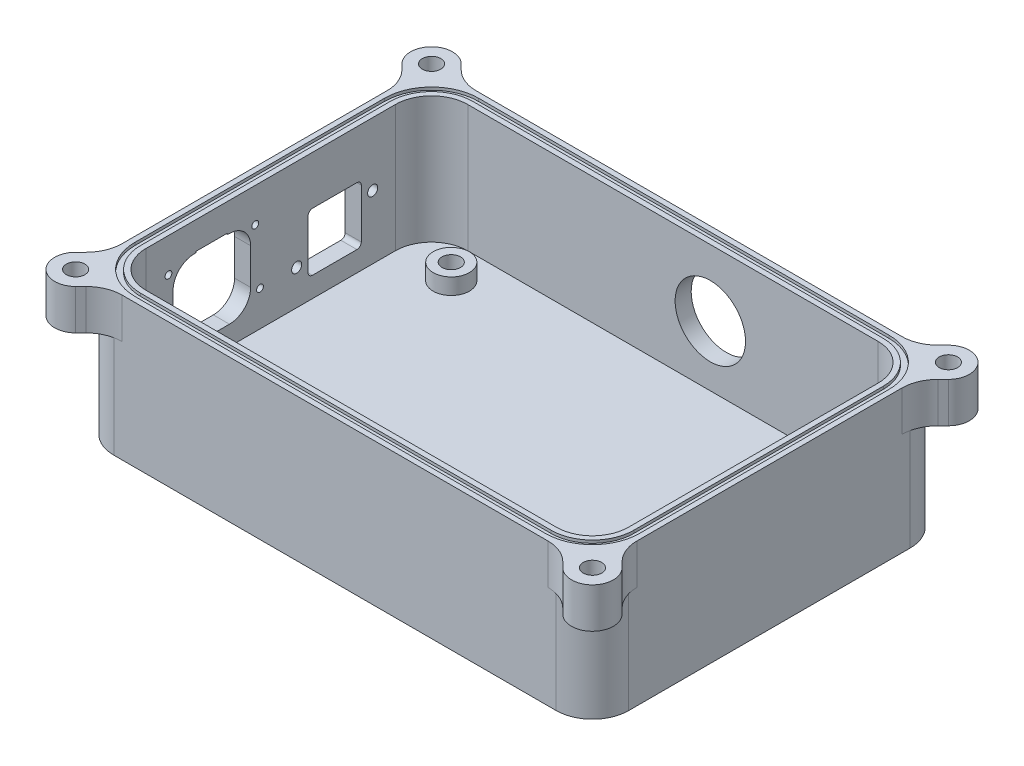
from build123d import *

# Parameters (mm, degrees)
SKETCH1_W                                = 152.4
SKETCH1_H                                = 101.6
BOSS_EXTRUDE1_DEPTH                      = 40.005
SHELL1_T                                 = 5.08
SKETCH5_R                                = 5.715
SKETCH5_R_2                              = 2.921
BOSS_EXTRUDE2_DEPTH                      = 5.08
SKETCH3_R                                = 1.6
SKETCH3_W                                = 10
SKETCH3_H                                = 0.4
CUT_EXTRUDE2_DEPTH                       = 5.08
BOSS_EXTRUDE3_DEPTH                      = 12.7
CUT_EXTRUDE3_DEPTH                       = 8.89
MIRROR1_AT_THE_SECOND_PLANE_COPY_1_DEPTH = 12.7
MIRROR1_AT_THE_SECOND_PLANE_COPY_2_DEPTH = 8.89
FILLET1_R                                = 11.43
FILLET2_R                                = 11.43
CUT_EXTRUDE4_DEPTH                       = 0.889
SKETCH10_R                               = 11.1125
CUT_EXTRUDE5_DEPTH                       = 5.08


with BuildPart() as part:
    # Sketch1 → Boss-Extrude1 (new body)
    with BuildSketch(Plane(origin=(0, 0, 0), x_dir=(1, 0, 0), z_dir=(0, 1, 0))):
        Rectangle(SKETCH1_W, SKETCH1_H)
    extrude(amount=BOSS_EXTRUDE1_DEPTH)

    # Shell1
    shell1_openings = [part.faces().sort_by_distance(p)[0] for p in [
        (0, 40.005, 0),
    ]]
    offset(amount=SHELL1_T, openings=shell1_openings, kind=Kind.INTERSECTION)

    # Sketch5 → Boss-Extrude2 (add)
    # profile 1 of 4: a face of its own
    with BuildSketch(Plane(origin=(0, 0, 0), x_dir=(-1, 0, 0), z_dir=(0, -1, 0))):
        with Locations(Location((59.182, 40.005, 0), (0, 0, 90))):
            Circle(SKETCH5_R)
        with Locations(Location((59.182, 40.005, 0), (0, 0, 90))):
            Circle(SKETCH5_R_2, mode=Mode.SUBTRACT)
    # profile 2 of 4: a face of its own
    with BuildSketch(Plane(origin=(0, 0, 0), x_dir=(-1, 0, 0), z_dir=(0, -1, 0))):
        with Locations(Location((-51.308, 40.005, 0), (0, 0, 90))):
            Circle(SKETCH5_R)
        with Locations(Location((-51.308, 40.005, 0), (0, 0, 90))):
            Circle(SKETCH5_R_2, mode=Mode.SUBTRACT)
    # profile 3 of 4: a face of its own
    with BuildSketch(Plane(origin=(0, 0, 0), x_dir=(-1, 0, 0), z_dir=(0, -1, 0))):
        with Locations(Location((-15.748, -24.765, 0), (0, 0, 90))):
            Circle(SKETCH5_R)
        with Locations(Location((-15.748, -24.765, 0), (0, 0, 90))):
            Circle(SKETCH5_R_2, mode=Mode.SUBTRACT)
    # profile 4 of 4: a face of its own
    with BuildSketch(Plane(origin=(0, 0, 0), x_dir=(-1, 0, 0), z_dir=(0, -1, 0))):
        with Locations(Location((59.182, -40.005, 0), (0, 0, 90))):
            Circle(SKETCH5_R)
        with Locations(Location((59.182, -40.005, 0), (0, 0, 90))):
            Circle(SKETCH5_R_2, mode=Mode.SUBTRACT)
    extrude(amount=-BOSS_EXTRUDE2_DEPTH)

    # Sketch3 → Cut-Extrude2 (cut)
    with BuildSketch(Plane(origin=(-81.28, 0, 0), x_dir=(0, 0, -1), z_dir=(1, 0, 0))):
        with BuildLine():
            ThreePointArc((13.196001907, 24.702820577), (12.220194549, 24.298627935), (11.816001907, 23.322820577))
            Line((11.816001907, 23.322820577), (11.816001907, 7.782820577))
            ThreePointArc((11.816001907, 7.782820577), (12.220194549, 6.807013219), (13.196001907, 6.402820577))
            Line((13.196001907, 6.402820577), (27.236001907, 6.402820577))
            ThreePointArc((27.236001907, 6.402820577), (28.211809265, 6.807013219), (28.616001907, 7.782820577))
            Line((28.616001907, 7.782820577), (28.616001907, 23.322820577))
            ThreePointArc((28.616001907, 23.322820577), (28.211809265, 24.298627935), (27.236001907, 24.702820577))
            Line((27.236001907, 24.702820577), (13.196001907, 24.702820577))
        make_face()
        with Locations(Location((32.21600191, 20.052820577, 0), (0, 0, 180))):
            Circle(SKETCH3_R)
        with Locations(Location((8.21600191, 11.052820577, 0), (0, 0, 180))):
            Circle(SKETCH3_R)
        with BuildLine():
            ThreePointArc((-24.109953079, 30.922549735), (-28.847568513, 28.960165169), (-30.809953079, 24.222549735))
            Line((-30.809953079, 24.222549735), (-30.809953079, 12.822549735))
            ThreePointArc((-30.809953079, 12.822549735), (-28.847568513, 8.084934302), (-24.109953079, 6.122549735))
            Line((-24.109953079, 6.122549735), (-13.009953079, 6.122549735))
            ThreePointArc((-13.009953079, 6.122549735), (-8.272337645, 8.084934302), (-6.309953079, 12.822549735))
            Line((-6.309953079, 12.822549735), (-6.309953079, 24.222549735))
            ThreePointArc((-6.309953079, 24.222549735), (-8.272337645, 28.960165169), (-13.009953079, 30.922549735))
            Line((-13.009953079, 30.922549735), (-24.109953079, 30.922549735))
        make_face()
        with BuildLine():
            add(Edge.make_bspline(
                [(-5.944953079, 29.222549735), (-5.944953079, 31.392549735), (-3.774953079, 31.392549735), (-3.774953079, 29.222549735)],
                knots=[0, 0, 0, 0, 1, 1, 1, 1], degree=3, weights=[1, 0.333333333, 0.333333333, 1]))
            add(Edge.make_bspline(
                [(-3.774953079, 29.222549735), (-3.774953079, 27.052549735), (-5.944953079, 27.052549735), (-5.944953079, 29.222549735)],
                knots=[0, 0, 0, 0, 1, 1, 1, 1], degree=3, weights=[1, 0.333333333, 0.333333333, 1]))
        make_face()
        with BuildLine():
            add(Edge.make_bspline(
                [(-4.444953079, 11.122549735), (-4.444953079, 13.292549735), (-2.274953079, 13.292549735), (-2.274953079, 11.122549735)],
                knots=[0, 0, 0, 0, 1, 1, 1, 1], degree=3, weights=[1, 0.333333333, 0.333333333, 1]))
            add(Edge.make_bspline(
                [(-2.274953079, 11.122549735), (-2.274953079, 8.952549735), (-4.444953079, 8.952549735), (-4.444953079, 11.122549735)],
                knots=[0, 0, 0, 0, 1, 1, 1, 1], degree=3, weights=[1, 0.333333333, 0.333333333, 1]))
        make_face()
        with BuildLine():
            add(Edge.make_bspline(
                [(-33.344953079, 29.222549735), (-33.344953079, 31.392549735), (-31.174953079, 31.392549735), (-31.174953079, 29.222549735)],
                knots=[0, 0, 0, 0, 1, 1, 1, 1], degree=3, weights=[1, 0.333333333, 0.333333333, 1]))
            add(Edge.make_bspline(
                [(-31.174953079, 29.222549735), (-31.174953079, 27.052549735), (-33.344953079, 27.052549735), (-33.344953079, 29.222549735)],
                knots=[0, 0, 0, 0, 1, 1, 1, 1], degree=3, weights=[1, 0.333333333, 0.333333333, 1]))
        make_face()
        with BuildLine():
            add(Edge.make_bspline(
                [(-34.844953079, 11.122549735), (-34.844953079, 13.292549735), (-32.674953079, 13.292549735), (-32.674953079, 11.122549735)],
                knots=[0, 0, 0, 0, 1, 1, 1, 1], degree=3, weights=[1, 0.333333333, 0.333333333, 1]))
            add(Edge.make_bspline(
                [(-32.674953079, 11.122549735), (-32.674953079, 8.952549735), (-34.844953079, 8.952549735), (-34.844953079, 11.122549735)],
                knots=[0, 0, 0, 0, 1, 1, 1, 1], degree=3, weights=[1, 0.333333333, 0.333333333, 1]))
        make_face()
        with Locations((-18.559953079, 31.122549735)):
            Rectangle(SKETCH3_W, SKETCH3_H)
    extrude(amount=CUT_EXTRUDE2_DEPTH, mode=Mode.SUBTRACT)

    # Sketch7 → Boss-Extrude3 (add)
    with BuildSketch(Plane(origin=(0, 40.005, 0), x_dir=(1, 0, 0), z_dir=(0, 1, 0))):
        with BuildLine():
            Line((-86.263383372, 51.512923973), (-76.2, 41.449540601))
            Line((-76.2, 41.449540601), (-76.2, 50.8))
            Line((-76.2, 50.8), (-66.849540601, 50.8))
            Line((-66.849540601, 50.8), (-76.912923973, 60.863383372))
            ThreePointArc((-76.912923973, 60.863383372), (-86.263383372, 60.863383372), (-86.263383372, 51.512923973))
        make_face()
    boss_extrude3 = extrude(amount=-BOSS_EXTRUDE3_DEPTH)

    # Sketch7<4> → Cut-Extrude3 (cut)
    with BuildSketch(Plane(origin=(0, 40.005, 0), x_dir=(1, 0, 0), z_dir=(0, 1, 0))):
        with BuildLine():
            ThreePointArc((-83.65361258, 58.25361258), (-84.509153673, 56.188153673), (-83.65361258, 54.122694765))
            Line((-83.65361258, 54.122694765), (-81.588153673, 56.188153673))
            Line((-81.588153673, 56.188153673), (-83.65361258, 58.25361258))
        make_face()
        with BuildLine():
            Line((-83.65361258, 58.25361258), (-81.588153673, 56.188153673))
            Line((-81.588153673, 56.188153673), (-79.522694765, 58.25361258))
            ThreePointArc((-79.522694765, 58.25361258), (-81.588153673, 59.109153673), (-83.65361258, 58.25361258))
        make_face()
        with BuildLine():
            Line((-81.588153673, 56.188153673), (-83.65361258, 54.122694765))
            ThreePointArc((-83.65361258, 54.122694765), (-82.56186402, 53.434223906), (-81.28, 53.283453634))
            Line((-81.28, 53.283453634), (-81.28, 55.88))
            Line((-81.28, 55.88), (-81.588153673, 56.188153673))
        make_face()
        with BuildLine():
            Line((-79.522694765, 58.25361258), (-81.588153673, 56.188153673))
            Line((-81.588153673, 56.188153673), (-81.28, 55.88))
            Line((-81.28, 55.88), (-78.683453634, 55.88))
            ThreePointArc((-78.683453634, 55.88), (-78.671231509, 56.033861438), (-78.667153673, 56.188153673))
            ThreePointArc((-78.667153673, 56.188153673), (-78.889501558, 57.305971979), (-79.522694765, 58.25361258))
        make_face()
        with BuildLine():
            Line((-81.28, 55.88), (-79.522694765, 54.122694765))
            ThreePointArc((-79.522694765, 54.122694765), (-78.95231407, 54.92934845), (-78.683453634, 55.88))
            Line((-78.683453634, 55.88), (-81.28, 55.88))
        make_face()
        with BuildLine():
            Line((-81.28, 55.88), (-81.28, 53.283453634))
            ThreePointArc((-81.28, 53.283453634), (-80.32934845, 53.55231407), (-79.522694765, 54.122694765))
            Line((-79.522694765, 54.122694765), (-81.28, 55.88))
        make_face()
    cut_extrude3 = extrude(amount=-CUT_EXTRUDE3_DEPTH, mode=Mode.SUBTRACT)

    # Mirror1: Boss-Extrude3, Cut-Extrude3 across plane
    add(boss_extrude3.mirror(Plane(origin=(0, 0, 0), x_dir=(0, 0, 1), z_dir=(1, 0, 0))))
    add(cut_extrude3.mirror(Plane(origin=(0, 0, 0), x_dir=(0, 0, 1), z_dir=(1, 0, 0))), mode=Mode.SUBTRACT)

    # Mirror1 at the second plane: Boss-Extrude3, Cut-Extrude3 across plane
    add(boss_extrude3.mirror(Plane.XY))
    add(cut_extrude3.mirror(Plane.XY), mode=Mode.SUBTRACT)

    # Mirror1 at the second plane copy 1 sketc → Mirror1 at the second plane copy 1 (add)
    with BuildSketch(Plane(origin=(0, 40.005, 0), x_dir=(-1, 0, 0), z_dir=(0, 1, 0))):
        with BuildLine():
            Line((-86.263383372, 51.512923973), (-76.2, 41.449540601))
            Line((-76.2, 41.449540601), (-76.2, 50.8))
            Line((-76.2, 50.8), (-66.849540601, 50.8))
            Line((-66.849540601, 50.8), (-76.912923973, 60.863383372))
            ThreePointArc((-76.912923973, 60.863383372), (-86.263383372, 60.863383372), (-86.263383372, 51.512923973))
        make_face()
    extrude(amount=-MIRROR1_AT_THE_SECOND_PLANE_COPY_1_DEPTH)

    # Mirror1 at the second plane copy 2 sketc → Mirror1 at the second plane copy 2 (cut)
    with BuildSketch(Plane(origin=(0, 40.005, 0), x_dir=(-1, 0, 0), z_dir=(0, 1, 0))):
        with BuildLine():
            ThreePointArc((-83.65361258, 58.25361258), (-84.509153673, 56.188153673), (-83.65361258, 54.122694765))
            Line((-83.65361258, 54.122694765), (-81.588153673, 56.188153673))
            Line((-81.588153673, 56.188153673), (-83.65361258, 58.25361258))
        make_face()
        with BuildLine():
            Line((-83.65361258, 58.25361258), (-81.588153673, 56.188153673))
            Line((-81.588153673, 56.188153673), (-79.522694765, 58.25361258))
            ThreePointArc((-79.522694765, 58.25361258), (-81.588153673, 59.109153673), (-83.65361258, 58.25361258))
        make_face()
        with BuildLine():
            Line((-81.588153673, 56.188153673), (-83.65361258, 54.122694765))
            ThreePointArc((-83.65361258, 54.122694765), (-82.56186402, 53.434223906), (-81.28, 53.283453634))
            Line((-81.28, 53.283453634), (-81.28, 55.88))
            Line((-81.28, 55.88), (-81.588153673, 56.188153673))
        make_face()
        with BuildLine():
            Line((-79.522694765, 58.25361258), (-81.588153673, 56.188153673))
            Line((-81.588153673, 56.188153673), (-81.28, 55.88))
            Line((-81.28, 55.88), (-78.683453634, 55.88))
            ThreePointArc((-78.683453634, 55.88), (-78.671231509, 56.033861438), (-78.667153673, 56.188153673))
            ThreePointArc((-78.667153673, 56.188153673), (-78.889501558, 57.305971979), (-79.522694765, 58.25361258))
        make_face()
        with BuildLine():
            Line((-81.28, 55.88), (-79.522694765, 54.122694765))
            ThreePointArc((-79.522694765, 54.122694765), (-78.95231407, 54.92934845), (-78.683453634, 55.88))
            Line((-78.683453634, 55.88), (-81.28, 55.88))
        make_face()
        with BuildLine():
            Line((-81.28, 55.88), (-81.28, 53.283453634))
            ThreePointArc((-81.28, 53.283453634), (-80.32934845, 53.55231407), (-79.522694765, 54.122694765))
            Line((-79.522694765, 54.122694765), (-81.28, 55.88))
        make_face()
    extrude(amount=-MIRROR1_AT_THE_SECOND_PLANE_COPY_2_DEPTH, mode=Mode.SUBTRACT)

    # Fillet1
    # the kernel refuses this fillet: 11.43 mm, written as the material it adds along each edge
    with BuildSketch(Plane(origin=(76.2, -28.575, 50.8), x_dir=(0, 0, -1), z_dir=(0, 1, 0))) as fillet1_piece_1_section:
        with BuildLine():
            CenterArc((FILLET1_R, FILLET1_R), FILLET1_R, 180, 90)
            Line((0, FILLET1_R), (0, 0))
            Line((0, 0), (FILLET1_R, 0))
        make_face()
    fillet1_piece_1 = extrude(amount=68.58, mode=Mode.PRIVATE)
    fillet1_piece_1 = split(fillet1_piece_1, bisect_by=Plane(origin=(73.646904458, -5.08, 48.246904458), z_dir=(0, 1, 0)), keep=Keep.TOP, mode=Mode.PRIVATE)
    add(fillet1_piece_1)
    with BuildSketch(Plane(origin=(76.2, -28.575, -50.8), x_dir=(-1, 0, 0), z_dir=(0, 1, 0))) as fillet1_piece_2_section:
        with BuildLine():
            CenterArc((FILLET1_R, FILLET1_R), FILLET1_R, 180, 90)
            Line((0, FILLET1_R), (0, 0))
            Line((0, 0), (FILLET1_R, 0))
        make_face()
    fillet1_piece_2 = extrude(amount=68.58, mode=Mode.PRIVATE)
    fillet1_piece_2 = split(fillet1_piece_2, bisect_by=Plane(origin=(73.646904458, -5.08, -48.246904458), z_dir=(0, 1, 0)), keep=Keep.TOP, mode=Mode.PRIVATE)
    add(fillet1_piece_2)
    with BuildSketch(Plane(origin=(-76.2, 40.005, -50.8), x_dir=(1, 0, 0), z_dir=(0, -1, 0))) as fillet1_piece_3_section:
        with BuildLine():
            CenterArc((FILLET1_R, FILLET1_R), FILLET1_R, 180, 90)
            Line((0, FILLET1_R), (0, 0))
            Line((0, 0), (FILLET1_R, 0))
        make_face()
    fillet1_piece_3 = extrude(amount=68.58, mode=Mode.PRIVATE)
    fillet1_piece_3 = split(fillet1_piece_3, bisect_by=Plane(origin=(-73.646904458, -5.08, -48.246904458), z_dir=(0, 1, 0)), keep=Keep.TOP, mode=Mode.PRIVATE)
    add(fillet1_piece_3)
    with BuildSketch(Plane(origin=(-76.2, 40.005, 50.8), x_dir=(0, 0, -1), z_dir=(0, -1, 0))) as fillet1_piece_4_section:
        with BuildLine():
            CenterArc((FILLET1_R, FILLET1_R), FILLET1_R, 180, 90)
            Line((0, FILLET1_R), (0, 0))
            Line((0, 0), (FILLET1_R, 0))
        make_face()
    fillet1_piece_4 = extrude(amount=68.58, mode=Mode.PRIVATE)
    fillet1_piece_4 = split(fillet1_piece_4, bisect_by=Plane(origin=(-73.646904458, -5.08, 48.246904458), z_dir=(0, 1, 0)), keep=Keep.TOP, mode=Mode.PRIVATE)
    add(fillet1_piece_4)
    # the kernel refuses this fillet: 11.43 mm, written as the material it takes off along each edge
    with BuildSketch(Plane(origin=(-81.28, -33.655, -55.88), x_dir=(1, 0, 0), z_dir=(0, 1, 0)), Plane(origin=(-81.28, -33.655, 55.88), x_dir=(0, 0, -1), z_dir=(0, 1, 0)), Plane(origin=(81.28, 27.305, -55.88), x_dir=(-1, 0, 0), z_dir=(0, -1, 0))) as fillet1_2_piece_1:
        with BuildLine():
            CenterArc((FILLET1_R, -FILLET1_R), FILLET1_R, 90, 90)
            Line((0, -FILLET1_R), (0, 0))
            Line((0, 0), (FILLET1_R, 0))
        make_face()
    extrude(amount=60.96, mode=Mode.SUBTRACT)
    with BuildSketch(Plane(origin=(-81.28, -33.655, -55.88), x_dir=(1, 0, 0), z_dir=(0, 1, 0))) as fillet1_2_piece_2_section:
        with BuildLine():
            CenterArc((FILLET1_R, -FILLET1_R), FILLET1_R, 90, 90)
            Line((0, -FILLET1_R), (0, 0))
            Line((0, 0), (FILLET1_R, 0))
        make_face()
    fillet1_2_piece_2 = extrude(amount=89.535, mode=Mode.PRIVATE)
    fillet1_2_piece_2 = split(fillet1_2_piece_2, bisect_by=Plane(origin=(-71.614645614, 29.21, -55.565105014), z_dir=(0.7071067811865486, 0, -0.7071067811865466)), keep=Keep.TOP, mode=Mode.PRIVATE)
    add(fillet1_2_piece_2, mode=Mode.SUBTRACT)
    with BuildSketch(Plane(origin=(-81.28, -33.655, -55.88), x_dir=(1, 0, 0), z_dir=(0, 1, 0))) as fillet1_2_piece_3_section:
        with BuildLine():
            CenterArc((FILLET1_R, -FILLET1_R), FILLET1_R, 90, 90)
            Line((0, -FILLET1_R), (0, 0))
            Line((0, 0), (FILLET1_R, 0))
        make_face()
    fillet1_2_piece_3 = extrude(amount=89.535, mode=Mode.PRIVATE)
    fillet1_2_piece_3 = split(fillet1_2_piece_3, bisect_by=Plane(origin=(-80.965105014, 29.21, -46.214645614), z_dir=(-0.7071067811865478, 0, 0.7071067811865474)), keep=Keep.TOP, mode=Mode.PRIVATE)
    add(fillet1_2_piece_3, mode=Mode.SUBTRACT)
    with BuildSketch(Plane(origin=(-81.28, -33.655, 55.88), x_dir=(0, 0, -1), z_dir=(0, 1, 0))) as fillet1_2_piece_4_section:
        with BuildLine():
            CenterArc((FILLET1_R, -FILLET1_R), FILLET1_R, 90, 90)
            Line((0, -FILLET1_R), (0, 0))
            Line((0, 0), (FILLET1_R, 0))
        make_face()
    fillet1_2_piece_4 = extrude(amount=89.535, mode=Mode.PRIVATE)
    fillet1_2_piece_4 = split(fillet1_2_piece_4, bisect_by=Plane(origin=(-80.965105014, 29.21, 46.214645614), z_dir=(-0.7071067811865478, 0, -0.7071067811865474)), keep=Keep.TOP, mode=Mode.PRIVATE)
    add(fillet1_2_piece_4, mode=Mode.SUBTRACT)
    with BuildSketch(Plane(origin=(-81.28, -33.655, 55.88), x_dir=(0, 0, -1), z_dir=(0, 1, 0))) as fillet1_2_piece_5_section:
        with BuildLine():
            CenterArc((FILLET1_R, -FILLET1_R), FILLET1_R, 90, 90)
            Line((0, -FILLET1_R), (0, 0))
            Line((0, 0), (FILLET1_R, 0))
        make_face()
    fillet1_2_piece_5 = extrude(amount=89.535, mode=Mode.PRIVATE)
    fillet1_2_piece_5 = split(fillet1_2_piece_5, bisect_by=Plane(origin=(-71.614645614, 29.21, 55.565105014), z_dir=(0.7071067811865486, 0, 0.7071067811865466)), keep=Keep.TOP, mode=Mode.PRIVATE)
    add(fillet1_2_piece_5, mode=Mode.SUBTRACT)
    with BuildSketch(Plane(origin=(81.28, -33.655, 55.88), x_dir=(0, 0, -1), z_dir=(0, 1, 0))) as fillet1_2_piece_6:
        with BuildLine():
            CenterArc((FILLET1_R, FILLET1_R), FILLET1_R, 180, 90)
            Line((0, FILLET1_R), (0, 0))
            Line((0, 0), (FILLET1_R, 0))
        make_face()
    extrude(amount=60.96, mode=Mode.SUBTRACT)
    with BuildSketch(Plane(origin=(81.28, -33.655, 55.88), x_dir=(0, 0, -1), z_dir=(0, 1, 0))) as fillet1_2_piece_7_section:
        with BuildLine():
            CenterArc((FILLET1_R, FILLET1_R), FILLET1_R, 180, 90)
            Line((0, FILLET1_R), (0, 0))
            Line((0, 0), (FILLET1_R, 0))
        make_face()
    fillet1_2_piece_7 = extrude(amount=89.535, mode=Mode.PRIVATE)
    fillet1_2_piece_7 = split(fillet1_2_piece_7, bisect_by=Plane(origin=(80.965105014, 29.21, 46.214645614), z_dir=(0.7071067811865478, 0, -0.7071067811865474)), keep=Keep.TOP, mode=Mode.PRIVATE)
    add(fillet1_2_piece_7, mode=Mode.SUBTRACT)
    with BuildSketch(Plane(origin=(81.28, -33.655, 55.88), x_dir=(0, 0, -1), z_dir=(0, 1, 0))) as fillet1_2_piece_8_section:
        with BuildLine():
            CenterArc((FILLET1_R, FILLET1_R), FILLET1_R, 180, 90)
            Line((0, FILLET1_R), (0, 0))
            Line((0, 0), (FILLET1_R, 0))
        make_face()
    fillet1_2_piece_8 = extrude(amount=89.535, mode=Mode.PRIVATE)
    fillet1_2_piece_8 = split(fillet1_2_piece_8, bisect_by=Plane(origin=(71.614645614, 29.21, 55.565105014), z_dir=(-0.7071067811865486, 0, 0.7071067811865466)), keep=Keep.TOP, mode=Mode.PRIVATE)
    add(fillet1_2_piece_8, mode=Mode.SUBTRACT)
    with BuildSketch(Plane(origin=(81.28, 55.88, -55.88), x_dir=(-1, 0, 0), z_dir=(0, -1, 0))) as fillet1_2_piece_9_section:
        with BuildLine():
            CenterArc((FILLET1_R, -FILLET1_R), FILLET1_R, 90, 90)
            Line((0, -FILLET1_R), (0, 0))
            Line((0, 0), (FILLET1_R, 0))
        make_face()
    fillet1_2_piece_9 = extrude(amount=89.535, mode=Mode.PRIVATE)
    fillet1_2_piece_9 = split(fillet1_2_piece_9, bisect_by=Plane(origin=(71.614645614, 35.56, -55.565105014), z_dir=(-0.7071067811865486, 0, -0.7071067811865466)), keep=Keep.TOP, mode=Mode.PRIVATE)
    add(fillet1_2_piece_9, mode=Mode.SUBTRACT)
    with BuildSketch(Plane(origin=(81.28, 55.88, -55.88), x_dir=(-1, 0, 0), z_dir=(0, -1, 0))) as fillet1_2_piece_10_section:
        with BuildLine():
            CenterArc((FILLET1_R, -FILLET1_R), FILLET1_R, 90, 90)
            Line((0, -FILLET1_R), (0, 0))
            Line((0, 0), (FILLET1_R, 0))
        make_face()
    fillet1_2_piece_10 = extrude(amount=89.535, mode=Mode.PRIVATE)
    fillet1_2_piece_10 = split(fillet1_2_piece_10, bisect_by=Plane(origin=(80.965105014, 35.56, -46.214645614), z_dir=(0.7071067811865478, 0, 0.7071067811865474)), keep=Keep.TOP, mode=Mode.PRIVATE)
    add(fillet1_2_piece_10, mode=Mode.SUBTRACT)

    # Fillet2
    # the kernel refuses this fillet: 11.43 mm, written as the material it adds along each edge
    with BuildSketch(Plane(origin=(-71.767544925, 40.005, -55.718004325), x_dir=(0.9993730002064656, 0, -0.035406305347036586), z_dir=(0, -1, 0)), Plane(origin=(-81.118004325, 40.005, 46.367544925), x_dir=(-0.035406305347029994, 0, -0.999373000206466), z_dir=(0, -1, 0)), Plane(origin=(71.767544925, 40.005, 55.718004325), x_dir=(-0.9993730002064654, 0, 0.035406305347044226), z_dir=(0, -1, 0)), Plane(origin=(71.767544925, 27.305, -55.718004325), x_dir=(-0.9993730002064656, 0, -0.035406305347039806), z_dir=(0, 1, 0))) as fillet2_piece_1:
        with BuildLine():
            CenterArc((4.980028146, -11.422833392), FILLET2_R, 92.029055955, 45)
            Line((-3.383296727, -3.631832362), (-4.219629215, -2.852732258))
            Line((-4.219629215, -2.852732258), (-0.836332487, 0.779100103))
            Line((-0.836332487, 0.779100103), (0.151738422, 1.132883247))
            ThreePointArc((0.151738422, 1.132883247), (1.881608886, 1.048282416), (4.534864669, 1.142283339))
            Line((4.534864669, 1.142283339), (4.575334076, 0))
        make_face()
    extrude(amount=12.7)
    with BuildSketch(Plane(origin=(-81.118004325, 40.005, -46.367544925), x_dir=(-0.03540630534703516, 0, 0.9993730002064658), z_dir=(0, -1, 0)), Plane(origin=(-71.767544925, 40.005, 55.718004325), x_dir=(0.9993730002064652, 0, 0.035406305347046224), z_dir=(0, -1, 0)), Plane(origin=(81.118004325, 40.005, 46.367544925), x_dir=(0.035406305347047994, 0, -0.9993730002064652), z_dir=(0, -1, 0)), Plane(origin=(81.118004325, 27.305, -46.367544925), x_dir=(0.03540630534704926, 0, 0.9993730002064652), z_dir=(0, 1, 0))) as fillet2_piece_2:
        with BuildLine():
            CenterArc((4.980028146, 11.422833392), FILLET2_R, 222.970944045, 45)
            Line((-3.383296727, 3.631832362), (-4.219629215, 2.852732258))
            Line((-4.219629215, 2.852732258), (-0.836332487, -0.779100103))
            Line((-0.836332487, -0.779100103), (0.151738422, -1.132883247))
            ThreePointArc((0.151738422, -1.132883247), (1.881608886, -1.048282416), (4.534864669, -1.142283339))
            Line((4.534864669, -1.142283339), (4.575334076, 0))
        make_face()
    extrude(amount=12.7)
    # the kernel refuses this fillet: 11.43 mm, written as the material it takes off along each edge

    # Sketch8 → Cut-Extrude4 (cut)
    with BuildSketch(Plane(origin=(0, 40.005, 0), x_dir=(1, 0, 0), z_dir=(0, 1, 0))):
        with BuildLine():
            Line((-79.629, 39.37), (-79.629, -39.37))
            ThreePointArc((-79.629, -39.37), (-75.276899662, -49.876899662), (-64.77, -54.229))
            Line((-64.77, -54.229), (64.77, -54.229))
            ThreePointArc((64.77, -54.229), (75.276899662, -49.876899662), (79.629, -39.37))
            Line((79.629, -39.37), (79.629, 39.37))
            ThreePointArc((79.629, 39.37), (75.276899662, 49.876899662), (64.77, 54.229))
            Line((64.77, 54.229), (-64.77, 54.229))
            ThreePointArc((-64.77, 54.229), (-75.276899662, 49.876899662), (-79.629, 39.37))
        make_face()
        with BuildLine():
            Line((-77.851, 39.37), (-77.851, -39.37))
            ThreePointArc((-77.851, -39.37), (-74.019663805, -48.619663805), (-64.77, -52.451))
            Line((-64.77, -52.451), (64.77, -52.451))
            ThreePointArc((64.77, -52.451), (74.019663805, -48.619663805), (77.851, -39.37))
            Line((77.851, -39.37), (77.851, 39.37))
            ThreePointArc((77.851, 39.37), (74.019663805, 48.619663805), (64.77, 52.451))
            Line((64.77, 52.451), (-64.77, 52.451))
            ThreePointArc((-64.77, 52.451), (-74.019663805, 48.619663805), (-77.851, 39.37))
        make_face(mode=Mode.SUBTRACT)
    extrude(amount=-CUT_EXTRUDE4_DEPTH, mode=Mode.SUBTRACT)

    # Sketch10 → Cut-Extrude5 (cut)
    with BuildSketch(Plane(origin=(0, 0, -55.88), x_dir=(-1, 0, 0), z_dir=(0, 0, -1))):
        with Locations((-11.80573992, 19.05)):
            Circle(SKETCH10_R)
    extrude(amount=-CUT_EXTRUDE5_DEPTH, mode=Mode.SUBTRACT)


solid = part.part
